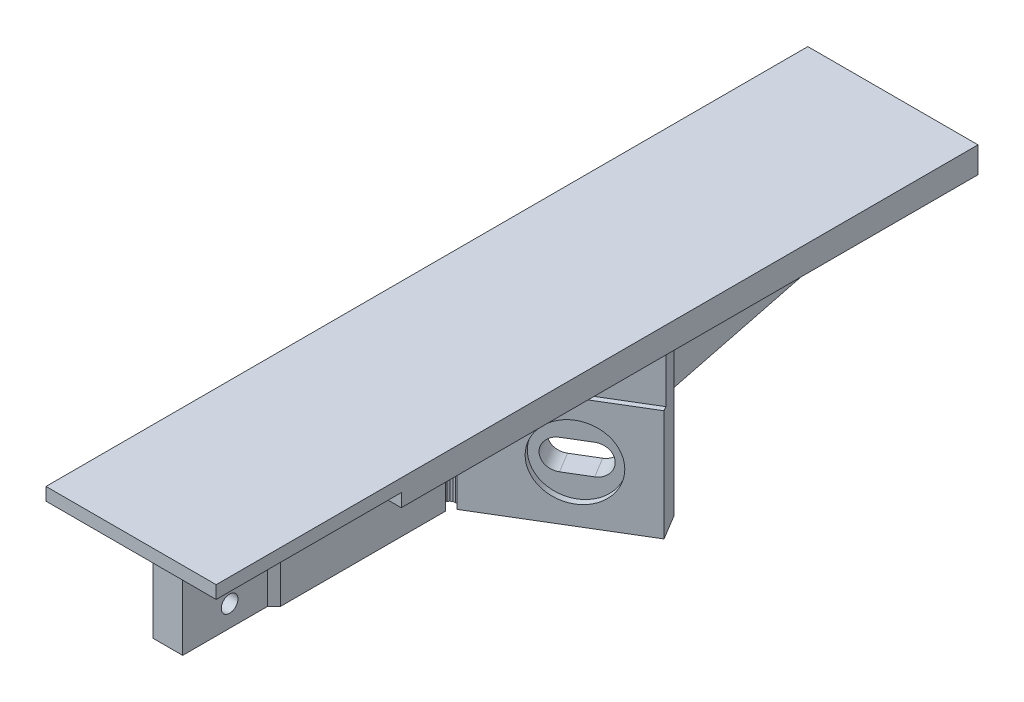
from build123d import *

# Parameters (mm, degrees)
LEG_AND_PAD_DEPTH                     = 13
SCREW_HEAD_RELIEF_SKETCH_W            = 14
SCREW_HEAD_RELIEF_SKETCH_H            = 6
SCREW_HEAD_RELIEF_DEPTH               = 2.35
M6_SLOT_MIDDLE_DEPTH                  = 3.5
SCREW_HOLES_SKETCH_R                  = 1.95
SCREW_HOLES_DEPTH                     = 4.5
FOOT_LEG_DEPTH                        = 6.1
SOLE_UNDER_THE_HOUSING_SKETCH_W       = 39.841788068
SOLE_UNDER_THE_HOUSING_SKETCH_H       = 135.03
SOLE_UNDER_THE_HOUSING_DEPTH          = 3.035
SOLE_UNDER_THE_BLOCK_SKETCH_W         = 39.841788068
SOLE_UNDER_THE_BLOCK_SKETCH_H         = 43.84
SOLE_UNDER_THE_BLOCK_DEPTH            = 1.5
SEAT_GUSSET_DEPTH                     = 2.55
TAIL_RIB_DEPTH                        = 3
SCREW_HEAD_RELIEF_TO_THE_END_SKETCH_W = 14
SCREW_HEAD_RELIEF_TO_THE_END_SKETCH_H = 16
SCREW_HEAD_RELIEF_TO_THE_END_DEPTH    = 2.35


with BuildPart() as part:
    # leg and pad sketch → leg and pad (new, symmetric)
    with BuildSketch(Plane(origin=(0, -20.7, 0), x_dir=(1, 0, 0), z_dir=(0, 1, 0))):
        Polygon((0.551289683, 30.332713936), (0.367250577, 30.819395741), (0.028023026, 31.213926146), (-0.425575667, 31.468833575), (-0.938966578, 31.553446481), (-1.450376329, 31.457583879), (-1.898269923, 31.192780366), (-2.228754897, 30.790898227), (-2.402065893, 30.30029363), (-2.397349395, 29.779998208), (-2.215172912, 29.292616119), (-1.877456693, 28.896791249), (-1.424836191, 28.640150931), (-0.91177263, 28.55357522), (-0.4, 28.647481273), (-0.4, -9.98), (-1.92, -11.5), (-1.92, -31.37), (-8.92, -31.37), (-8.92, 32.792642706), (27.204821487, 54.594667874), (30.821788068, 48.601542416), align=None)
    extrude(amount=LEG_AND_PAD_DEPTH, both=True)

    # screw head relief sketch → screw head relief (cut, symmetric)
    with BuildSketch(Plane(origin=(-1.35, 0, 0), x_dir=(0, 0, -1), z_dir=(1, 0, 0))):
        with Locations((16.4, -9.7)):
            Rectangle(SCREW_HEAD_RELIEF_SKETCH_W, SCREW_HEAD_RELIEF_SKETCH_H)
    extrude(amount=SCREW_HEAD_RELIEF_DEPTH, both=True, mode=Mode.SUBTRACT)

    # insert flange relief sketch → insert flange relief (revolve, cut)
    with BuildSketch(Plane(origin=(0, -20.7, 0), x_dir=(1, 0, 0), z_dir=(0, 1, 0))):
        Polygon((18.324853729, 39.891397061), (17.03307995, 42.03179901), (9.755713323, 37.639768162), (11.047487102, 35.499366213), align=None)
    revolve(axis=Axis((18.324853729, -20.7, -39.891397061), (-0.5167095115681243, 0, -0.8561607796757748)), mode=Mode.SUBTRACT)

    # M6 slot end 1 sketch → M6 slot end 1 (revolve, cut)
    with BuildSketch(Plane(origin=(0, -20.7, 0), x_dir=(1, 0, 0), z_dir=(0, 1, 0))):
        Polygon((20.893336068, 41.441525596), (16.242950464, 49.146972613), (13.246387735, 47.338489322), (17.896773339, 39.633042305), align=None)
    revolve(axis=Axis((20.893336068, -20.7, -41.441525596), (-0.5167095115681233, 0, -0.8561607796757753)), mode=Mode.SUBTRACT)

    # M6 slot end 2 sketch → M6 slot end 2 (revolve, cut)
    with BuildSketch(Plane(origin=(0, -20.7, 0), x_dir=(1, 0, 0), z_dir=(0, 1, 0))):
        Polygon((15.75637139, 38.341268526), (11.105985786, 46.046715543), (8.109423057, 44.238232253), (12.759808661, 36.532785236), align=None)
    revolve(axis=Axis((15.75637139, -20.7, -38.341268526), (-0.5167095115681234, 0, -0.8561607796757752)), mode=Mode.SUBTRACT)

    # M6 slot middle sketch → M6 slot middle (cut, symmetric)
    with BuildSketch(Plane(origin=(0, -20.7, 0), x_dir=(1, 0, 0), z_dir=(0, 1, 0))):
        Polygon((15.75637139, 38.341268526), (20.893336068, 41.441525596), (16.242950464, 49.146972613), (11.105985786, 46.046715543), align=None)
    extrude(amount=M6_SLOT_MIDDLE_DEPTH, both=True, mode=Mode.SUBTRACT)

    # screw holes sketch → screw holes (cut, symmetric)
    with BuildSketch(Plane(origin=(-5.42, 0, 0), x_dir=(0, 0, -1), z_dir=(1, 0, 0))):
        with Locations((-20.375, -28.7)):
            Circle(SCREW_HOLES_SKETCH_R)
        with Locations((-20.375, -12.7)):
            Circle(SCREW_HOLES_SKETCH_R)
    extrude(amount=SCREW_HOLES_DEPTH, both=True, mode=Mode.SUBTRACT)

    # foot leg sketch → foot leg (add, symmetric)
    with BuildSketch(Plane(origin=(0, -2.1, 0), x_dir=(1, 0, 0), z_dir=(0, 1, 0))):
        Polygon((-2.3, 30.013511625), (-2.3, -9.98), (-8.92, -9.98), (-8.92, 32.792642706), (27.204821487, 54.594667874), (30.201736654, 49.628935352), align=None)
    extrude(amount=FOOT_LEG_DEPTH, both=True)

    # sole under the housing sketch → sole under the housing (add, symmetric)
    with BuildSketch(Plane(origin=(0, 6.535, 0), x_dir=(1, 0, 0), z_dir=(0, 1, 0))):
        with Locations((11.000894034, 54.485)):
            Rectangle(SOLE_UNDER_THE_HOUSING_SKETCH_W, SOLE_UNDER_THE_HOUSING_SKETCH_H)
    extrude(amount=SOLE_UNDER_THE_HOUSING_DEPTH, both=True)

    # sole under the block sketch → sole under the block (add, symmetric)
    with BuildSketch(Plane(origin=(0, 8.07, 0), x_dir=(1, 0, 0), z_dir=(0, 1, 0))):
        with Locations((11.000894034, -34.45)):
            Rectangle(SOLE_UNDER_THE_BLOCK_SKETCH_W, SOLE_UNDER_THE_BLOCK_SKETCH_H)
    extrude(amount=SOLE_UNDER_THE_BLOCK_DEPTH, both=True)

    # seat gusset sketch → seat gusset (add, symmetric)
    with BuildSketch(Plane(origin=(-6.37, 0, 0), x_dir=(0, 0, -1), z_dir=(1, 0, 0))):
        Polygon((-9.48, -8.2), (-31.37, -8.2), (-31.37, -7.7), (-17.1, 7.07), (-9.48, 7.07), align=None)
    extrude(amount=SEAT_GUSSET_DEPTH, both=True)

    # tail rib sketch → tail rib (add, symmetric)
    with BuildSketch(Plane(origin=(19.921788068, 0, 0), x_dir=(0, 0, -1), z_dir=(1, 0, 0))):
        Polygon((53.1, 4), (53.1, -12.5), (57.1, -12.5), (120, 3.5), (120, 4), align=None)
    extrude(amount=TAIL_RIB_DEPTH, both=True)

    # screw head relief to the end sketch → screw head relief to the end (cut, symmetric)
    with BuildSketch(Plane(origin=(-1.35, 0, 0), x_dir=(0, 0, -1), z_dir=(1, 0, 0))):
        with Locations((16.4, -4.7)):
            Rectangle(SCREW_HEAD_RELIEF_TO_THE_END_SKETCH_W, SCREW_HEAD_RELIEF_TO_THE_END_SKETCH_H)
    extrude(amount=SCREW_HEAD_RELIEF_TO_THE_END_DEPTH, both=True, mode=Mode.SUBTRACT)


solid = part.part
